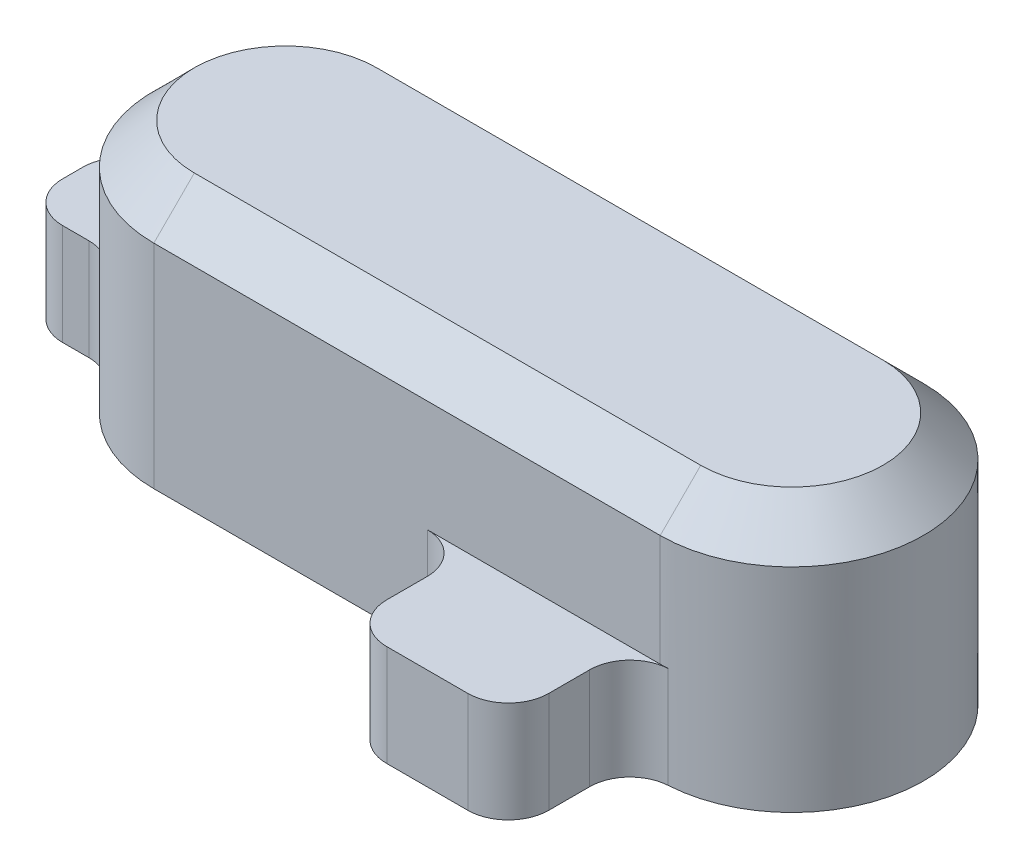
from build123d import *

# Parameters (mm, degrees)
BOSS_EXTRUDE1_DEPTH = 3.175
SKETCH2_W           = 2.032
SKETCH2_H           = 1.524
SKETCH2_H_2         = 1.27
BOSS_EXTRUDE2_DEPTH = 1.27
CHAMFER1_SIZE       = 0.508
FILLET1_R           = 0.508


with BuildPart() as part:
    # Sketch1 → Boss-Extrude1 (new body)
    with BuildSketch(Plane(origin=(0, 0, 0), x_dir=(1, 0, 0), z_dir=(0, 1, 0))):
        with BuildLine():
            Line((-3.175, 1.651), (3.175, 1.651))
            ThreePointArc((3.175, 1.651), (4.826, 0), (3.175, -1.651))
            Line((3.175, -1.651), (-3.175, -1.651))
            ThreePointArc((-3.175, -1.651), (-4.826, 0), (-3.175, 1.651))
        make_face()
    extrude(amount=BOSS_EXTRUDE1_DEPTH)

    # Sketch2 → Boss-Extrude2 (add)
    with BuildSketch(Plane.XZ):
        with Locations((1.778, 2.413)):
            Rectangle(SKETCH2_W, SKETCH2_H)
        with Locations((-4.826, 0)):
            Rectangle(SKETCH2_W, SKETCH2_H_2)
    extrude(amount=-BOSS_EXTRUDE2_DEPTH)

    # Chamfer1
    chamfer1_edges = [part.edges().sort_by_distance(p)[0] for p in [
        (4.826, 3.175, 0),
        (0, 3.175, -1.651),
        (-4.826, 3.175, 0),
        (0, 3.175, 1.651),
    ]]
    chamfer(chamfer1_edges, length=CHAMFER1_SIZE)

    # Fillet1
    # the kernel refuses this fillet: 0.508 mm, written as the material it adds along each edge
    with BuildSketch(Plane(origin=(0.762, 0, 1.651), x_dir=(-1, 0, 0), z_dir=(0, 1, 0))) as fillet1_piece_1:
        with BuildLine():
            CenterArc((FILLET1_R, FILLET1_R), FILLET1_R, 180, 90)
            Line((0, FILLET1_R), (0, 0))
            Line((0, 0), (FILLET1_R, 0))
        make_face()
    extrude(amount=1.27)
    with BuildSketch(Plane(origin=(2.794, 0, 1.651), x_dir=(0.999982123617744, 0, -0.005979334824793291), z_dir=(0, 1, 0))) as fillet1_piece_2:
        with BuildLine():
            CenterArc((0.504975771, -0.507289957), FILLET1_R, 93.029693992, 86.627713317)
            Line((-0.003015148, -0.504252455), (-0.05381424, -0.503948704))
            Line((-0.05381424, -0.503948704), (-0.050799092, 0.00030375))
            Line((-0.050799092, 0.00030375), (0.00030375, 0.050799092))
            ThreePointArc((0.00030375, 0.050799092), (0.381296939, 0.048520965), (0.475441237, 0.050728996))
            Line((0.475441237, 0.050728996), (0.478126194, 0))
        make_face()
    extrude(amount=1.27)
    with BuildSketch(Plane(origin=(-4.699, 1.27, -0.635), x_dir=(0.45853775751047177, 0, -0.8886749264704544), z_dir=(0, -1, 0))) as fillet1_piece_3:
        with BuildLine():
            CenterArc((0.310391456, -0.506311404), FILLET1_R, 94.672926901, 58.034281249)
            Line((-0.141055407, -0.273374223), (0, 0))
            ThreePointArc((0, 0), (0.134502964, -0.005487936), (0.269005928, 0))
        make_face()
    extrude(amount=1.27)
    with BuildSketch(Plane(origin=(-4.699, 1.27, 0.635), x_dir=(0.45853775751047327, 0, 0.8886749264704539), z_dir=(0, -1, 0))) as fillet1_piece_4:
        with BuildLine():
            CenterArc((0.310391456, 0.506311404), FILLET1_R, 207.292791849, 58.034281249)
            Line((-0.141055407, 0.273374223), (0, 0))
            ThreePointArc((0, 0), (0.134502964, 0.005487936), (0.269005928, 0))
        make_face()
    extrude(amount=1.27)
    # the kernel refuses this fillet: 0.508 mm, written as the material it takes off along each edge
    with BuildSketch(Plane(origin=(0.762, -1.27, 3.175), x_dir=(0, 0, -1), z_dir=(0, 1, 0)), Plane(origin=(2.794, -1.27, 3.175), x_dir=(-1, 0, 0), z_dir=(0, 1, 0)), Plane(origin=(-5.842, -1.27, 0.635), x_dir=(0, 0, -1), z_dir=(0, 1, 0))) as fillet1_2_piece_1:
        with BuildLine():
            CenterArc((FILLET1_R, -FILLET1_R), FILLET1_R, 90, 90)
            Line((0, -FILLET1_R), (0, 0))
            Line((0, 0), (FILLET1_R, 0))
        make_face()
    extrude(amount=3.81, mode=Mode.SUBTRACT)
    with BuildSketch(Plane(origin=(-5.842, -1.27, -0.635), x_dir=(0, 0, 1), z_dir=(0, 1, 0))) as fillet1_2_piece_2:
        with BuildLine():
            CenterArc((FILLET1_R, FILLET1_R), FILLET1_R, 180, 90)
            Line((0, FILLET1_R), (0, 0))
            Line((0, 0), (FILLET1_R, 0))
        make_face()
    extrude(amount=3.81, mode=Mode.SUBTRACT)


solid = part.part
